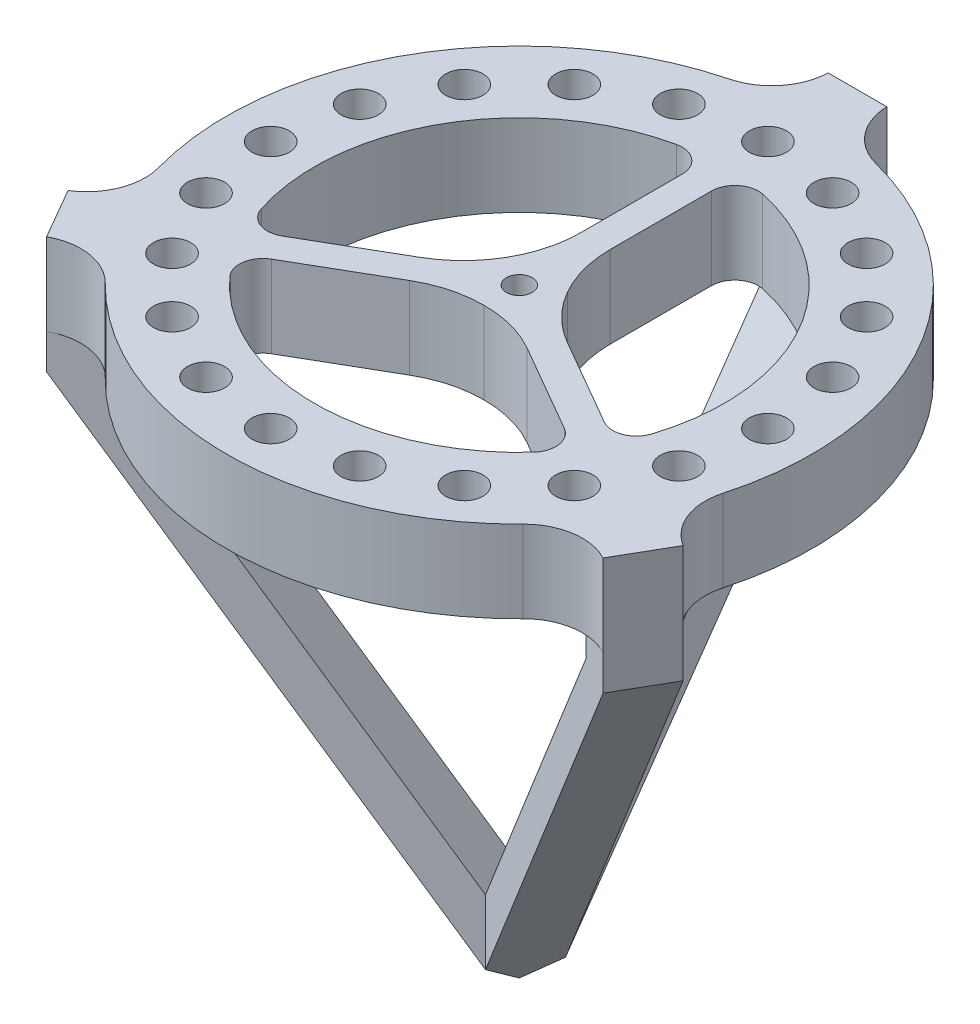
from build123d import *

# Parameters (mm, degrees)
SKETCH1_R           = 3
SKETCH1_R_2         = 1.1
BOSS_EXTRUDE1_DEPTH = 5
SKETCH4_R           = 25
SKETCH4_R_2         = 17.5
BOSS_EXTRUDE2_DEPTH = 5
SKETCH5_W           = 2.5
SKETCH5_H           = 14.772821971
BOSS_EXTRUDE3_DEPTH = 5
CIRPATTERN1_COUNT   = 3
SKETCH6_R           = 1.59
CUT_EXTRUDE1_DEPTH  = 5
FILLET1_R           = 10
FILLET2_R           = 2
CIRPATTERN2_COUNT   = 20
BOSS_EXTRUDE4_START = 2
SKETCH7_R           = 25
BOSS_EXTRUDE4_DEPTH = 2
CUT_EXTRUDE2_START  = -3
SKETCH8_R           = 1.1
CUT_EXTRUDE2_DEPTH  = 3
BOSS_EXTRUDE5_START = -10
BOSS_EXTRUDE5_DEPTH = 10
BOSS_EXTRUDE6_DEPTH = 2.5
CIRPATTERN3_COUNT   = 3
FILLET3_R           = 5
CUT_EXTRUDE6_DEPTH  = 10
CUT_EXTRUDE8_DEPTH  = 10
CUT_EXTRUDE9_DEPTH  = 10


with BuildPart() as part:
    # Sketch1 → Boss-Extrude1 (new body)
    with BuildSketch(Plane(origin=(0, 0, 0), x_dir=(1, 0, 0), z_dir=(0, 1, 0))):
        with Locations(Location((0, 0, 0), (0, 0, 270))):
            Circle(SKETCH1_R)
        with Locations(Location((0, 0, 0), (0, 0, 270))):
            Circle(SKETCH1_R_2, mode=Mode.SUBTRACT)
    extrude(amount=BOSS_EXTRUDE1_DEPTH)



with BuildPart() as body_2:
    # Sketch4 → Boss-Extrude2 (new body)
    with BuildSketch(Plane(origin=(0, 0, 0), x_dir=(1, 0, 0), z_dir=(0, 1, 0))):
        with Locations(Location((0, 0, 0), (0, 0, 270))):
            Circle(SKETCH4_R)
        with Locations(Location((0, 0, 0), (0, 0, 270))):
            Circle(SKETCH4_R_2, mode=Mode.SUBTRACT)
    extrude(amount=BOSS_EXTRUDE2_DEPTH)


with BuildPart() as part_1:
    add(part.part)

    add(body_2.part)  # Boss-Extrude3 merges body 2
    # Sketch5 → Boss-Extrude3 (add)
    with BuildSketch(Plane(origin=(0, 5, 0), x_dir=(1, 0, 0), z_dir=(0, 1, 0))):
        with Locations((0, 10.113589015)):
            Rectangle(SKETCH5_W, SKETCH5_H)
    boss_extrude3 = extrude(amount=-BOSS_EXTRUDE3_DEPTH)

    # CirPattern1: Boss-Extrude3 ×3 about axis
    cirpattern1_axis = Axis((0, 0, 0), (0, 1, 0))
    for i in range(1, CIRPATTERN1_COUNT):
        add(boss_extrude3.rotate(cirpattern1_axis, i * 360 / CIRPATTERN1_COUNT))

    # Sketch6 → Cut-Extrude1 (cut)
    with BuildSketch(Plane(origin=(0, 5, 0), x_dir=(1, 0, 0), z_dir=(0, 1, 0))):
        with Locations(Location((0, 21.227650027, 0), (0, 0, 270))):
            Circle(SKETCH6_R)
    cut_extrude1 = extrude(amount=-CUT_EXTRUDE1_DEPTH, mode=Mode.SUBTRACT)

    # Fillet1
    fillet1_edges = [part_1.edges().sort_by_distance(p)[0] for p in [
        (1.25, 2.5, -2.727178029),
        (-1.25, 2.5, -2.727178029),
        (1.736805453, 2.5, 2.446120769),
        (2.986805453, 2.5, 0.28105726),
        (-2.986805453, 2.5, 0.28105726),
        (-1.736805453, 2.5, 2.446120769),
    ]]
    fillet(fillet1_edges, radius=FILLET1_R)

    # Fillet2
    fillet2_edges = [part_1.edges().sort_by_distance(p)[0] for p in [
        (1.25, 2.5, -17.455300055),
        (-1.25, 2.5, -17.455300055),
        (15.741733278, 2.5, 7.645118273),
        (14.491733278, 2.5, 9.810181782),
        (-15.741733278, 2.5, 7.645118273),
        (-14.491733278, 2.5, 9.810181782),
    ]]
    fillet(fillet2_edges, radius=FILLET2_R)

    # CirPattern2: Cut-Extrude1 ×20 about axis
    cirpattern2_axis = Axis((0, 0, 0), (0, 1, 0))
    for i in range(1, CIRPATTERN2_COUNT):
        add(cut_extrude1.rotate(cirpattern2_axis, i * 360 / CIRPATTERN2_COUNT), mode=Mode.SUBTRACT)

    # Sketch7 → Boss-Extrude4 (add)
    with BuildSketch(Plane.XZ.offset(BOSS_EXTRUDE4_START)):
        with Locations(Location((0, 0, 0), (0, 0, 270))):
            Circle(SKETCH7_R)
        Polygon((7.540965356, 23.20870493), (4.434929563, 22.548496642), (3.453668816, 19.528486596), (5.578443862, 17.168684838), (8.684479655, 17.828893126), (9.665740402, 20.848903173), align=None, mode=Mode.SUBTRACT)
        Polygon((0, 24.403076508), (-2.75, 22.815363268), (-2.75, 19.639936787), (0, 18.052223547), (2.75, 19.639936787), (2.75, 22.815363268), align=None, mode=Mode.SUBTRACT)
        Polygon((14.343768482, 19.74250361), (11.18573732, 20.07442606), (9.319268465, 17.505452073), (10.610830772, 14.604555636), (13.768861934, 14.272633185), (15.635330789, 16.841607173), align=None, mode=Mode.SUBTRACT)
        Polygon((19.74250361, 14.343768482), (16.841607173, 15.635330789), (14.272633185, 13.768861934), (14.604555636, 10.610830772), (17.505452073, 9.319268465), (20.07442606, 11.18573732), align=None, mode=Mode.SUBTRACT)
        Polygon((23.20870493, 7.540965356), (20.848903173, 9.665740402), (17.828893126, 8.684479655), (17.168684838, 5.578443862), (19.528486596, 3.453668816), (22.548496642, 4.434929563), align=None, mode=Mode.SUBTRACT)
        Polygon((24.403076508, 0), (22.815363268, 2.75), (19.639936787, 2.75), (18.052223547, 0), (19.639936787, -2.75), (22.815363268, -2.75), align=None, mode=Mode.SUBTRACT)
        Polygon((23.20870493, -7.540965356), (22.548496642, -4.434929563), (19.528486596, -3.453668816), (17.168684838, -5.578443862), (17.828893126, -8.684479655), (20.848903173, -9.665740402), align=None, mode=Mode.SUBTRACT)
        Polygon((19.74250361, -14.343768482), (20.07442606, -11.18573732), (17.505452073, -9.319268465), (14.604555636, -10.610830772), (14.272633185, -13.768861934), (16.841607173, -15.635330789), align=None, mode=Mode.SUBTRACT)
        Polygon((14.343768482, -19.74250361), (15.635330789, -16.841607173), (13.768861934, -14.272633185), (10.610830772, -14.604555636), (9.319268465, -17.505452073), (11.18573732, -20.07442606), align=None, mode=Mode.SUBTRACT)
        Polygon((7.540965356, -23.20870493), (9.665740402, -20.848903173), (8.684479655, -17.828893126), (5.578443862, -17.168684838), (3.453668816, -19.528486596), (4.434929563, -22.548496642), align=None, mode=Mode.SUBTRACT)
        Polygon((0, -24.403076508), (2.75, -22.815363268), (2.75, -19.639936787), (0, -18.052223547), (-2.75, -19.639936787), (-2.75, -22.815363268), align=None, mode=Mode.SUBTRACT)
        Polygon((-7.540965356, -23.20870493), (-4.434929563, -22.548496642), (-3.453668816, -19.528486596), (-5.578443862, -17.168684838), (-8.684479655, -17.828893126), (-9.665740402, -20.848903173), align=None, mode=Mode.SUBTRACT)
        Polygon((-14.343768482, -19.74250361), (-11.18573732, -20.07442606), (-9.319268465, -17.505452073), (-10.610830772, -14.604555636), (-13.768861934, -14.272633185), (-15.635330789, -16.841607173), align=None, mode=Mode.SUBTRACT)
        Polygon((-19.74250361, -14.343768482), (-16.841607173, -15.635330789), (-14.272633185, -13.768861934), (-14.604555636, -10.610830772), (-17.505452073, -9.319268465), (-20.07442606, -11.18573732), align=None, mode=Mode.SUBTRACT)
        Polygon((-23.20870493, -7.540965356), (-20.848903173, -9.665740402), (-17.828893126, -8.684479655), (-17.168684838, -5.578443862), (-19.528486596, -3.453668816), (-22.548496642, -4.434929563), align=None, mode=Mode.SUBTRACT)
        Polygon((-24.403076508, 0), (-22.815363268, -2.75), (-19.639936787, -2.75), (-18.052223547, 0), (-19.639936787, 2.75), (-22.815363268, 2.75), align=None, mode=Mode.SUBTRACT)
        Polygon((-23.20870493, 7.540965356), (-22.548496642, 4.434929563), (-19.528486596, 3.453668816), (-17.168684838, 5.578443862), (-17.828893126, 8.684479655), (-20.848903173, 9.665740402), align=None, mode=Mode.SUBTRACT)
        Polygon((-19.74250361, 14.343768482), (-20.07442606, 11.18573732), (-17.505452073, 9.319268465), (-14.604555636, 10.610830772), (-14.272633185, 13.768861934), (-16.841607173, 15.635330789), align=None, mode=Mode.SUBTRACT)
        Polygon((-14.343768482, 19.74250361), (-15.635330789, 16.841607173), (-13.768861934, 14.272633185), (-10.610830772, 14.604555636), (-9.319268465, 17.505452073), (-11.18573732, 20.07442606), align=None, mode=Mode.SUBTRACT)
        Polygon((-7.540965356, 23.20870493), (-9.665740402, 20.848903173), (-8.684479655, 17.828893126), (-5.578443862, 17.168684838), (-3.453668816, 19.528486596), (-4.434929563, 22.548496642), align=None, mode=Mode.SUBTRACT)
    extrude(amount=-BOSS_EXTRUDE4_DEPTH)

    # Sketch8 → Cut-Extrude2 (cut)
    with BuildSketch(Plane(origin=(0, 0, 0), x_dir=(1, 0, 0), z_dir=(0, 1, 0)).offset(CUT_EXTRUDE2_START)):
        with Locations(Location((0, 0, 0), (0, 0, 90))):
            Circle(SKETCH8_R)
        with BuildLine():
            Line((1.25, 15.155444566), (1.25, 6.51440711))
            ThreePointArc((1.25, 6.51440711), (1.592400362, 3.920034502), (2.596153846, 1.503324718))
            Line((2.596153846, 1.503324718), (2.599994319, 1.496672824))
            ThreePointArc((2.599994319, 1.496672824), (4.191049643, -0.580958085), (6.266642048, -2.1746718))
            Line((6.266642048, -2.1746718), (13.75, -6.495190528))
            ThreePointArc((13.75, -6.495190528), (15.468421208, -6.629652771), (16.653225806, -5.377738394))
            ThreePointArc((16.653225806, -5.377738394), (15.155444566, 8.75), (3.669354839, 17.110985801))
            ThreePointArc((3.669354839, 17.110985801), (1.992762886, 16.710872108), (1.25, 15.155444566))
        make_face()
        with BuildLine():
            Line((-2.599994319, 1.496672824), (-2.596153846, 1.503324718))
            ThreePointArc((-2.596153846, 1.503324718), (-1.592400362, 3.920034502), (-1.25, 6.51440711))
            Line((-1.25, 6.51440711), (-1.25, 15.155444566))
            ThreePointArc((-1.25, 15.155444566), (-1.992762886, 16.710872108), (-3.669354839, 17.110985801))
            ThreePointArc((-3.669354839, 17.110985801), (-15.155444566, 8.75), (-16.653225806, -5.377738394))
            ThreePointArc((-16.653225806, -5.377738394), (-15.468421208, -6.629652771), (-13.75, -6.495190528))
            Line((-13.75, -6.495190528), (-6.266642048, -2.1746718))
            ThreePointArc((-6.266642048, -2.1746718), (-4.191049643, -0.580958085), (-2.599994319, 1.496672824))
        make_face()
        with BuildLine():
            Line((0.003840473, -2.999997542), (-0.003840473, -2.999997542))
            ThreePointArc((-0.003840473, -2.999997542), (-2.598649282, -3.339076417), (-5.016642048, -4.33973531))
            Line((-5.016642048, -4.33973531), (-12.5, -8.660254038))
            ThreePointArc((-12.5, -8.660254038), (-13.475658322, -10.081219337), (-12.983870968, -11.733247406))
            ThreePointArc((-12.983870968, -11.733247406), (0, -17.5), (12.983870968, -11.733247406))
            ThreePointArc((12.983870968, -11.733247406), (13.475658322, -10.081219337), (12.5, -8.660254038))
            Line((12.5, -8.660254038), (5.016642048, -4.33973531))
            ThreePointArc((5.016642048, -4.33973531), (2.598649282, -3.339076417), (0.003840473, -2.999997542))
        make_face()
    extrude(amount=CUT_EXTRUDE2_DEPTH, mode=Mode.SUBTRACT)

    # Sketch9 → Boss-Extrude5 (add)
    with BuildSketch(Plane(origin=(0, 5, 0), x_dir=(1, 0, 0), z_dir=(0, 1, 0)).offset(BOSS_EXTRUDE5_START)):
        with BuildLine():
            Line((-2.5, 24.874685928), (-2.5, 28.874685928))
            Line((-2.5, 28.874685928), (2.5, 28.874685928))
            Line((2.5, 28.874685928), (2.5, 24.874685928))
            ThreePointArc((2.5, 24.874685928), (0, 25), (-2.5, 24.874685928))
        make_face()
    boss_extrude5 = extrude(amount=BOSS_EXTRUDE5_DEPTH)

    # Sketch10 → Boss-Extrude6 (add, symmetric)
    with BuildSketch(Plane(origin=(0, 0, 0), x_dir=(0, 0, -1), z_dir=(1, 0, 0))):
        Polygon((28.874685928, -5), (0, -46.237325153), (0, -40.703700169), (25, -5), align=None)
    boss_extrude6 = extrude(amount=BOSS_EXTRUDE6_DEPTH, both=True)

    # CirPattern3: Boss-Extrude5, Boss-Extrude6 ×3 about axis
    cirpattern3_axis = Axis((0, 0, 0), (0, 1, 0))
    add([boss_extrude5.rotate(cirpattern3_axis, i * 360 / CIRPATTERN3_COUNT) for i in range(1, CIRPATTERN3_COUNT)])
    add([boss_extrude6.rotate(cirpattern3_axis, i * 360 / CIRPATTERN3_COUNT) for i in range(1, CIRPATTERN3_COUNT)])

    # Fillet3
    # the kernel refuses this fillet: 5 mm, written as the material it adds along each edge
    with BuildSketch(Plane(origin=(-22.792109925, -2, 10.272279454), x_dir=(-0.3402913748716829, 0, -0.940320041362482), z_dir=(0, 1, 0)), Plane(origin=(20.292109925, -2, 14.602406473), x_dir=(-0.6441953560717024, 0, 0.7648609960088516), z_dir=(0, 1, 0)), Plane(origin=(-2.5, 5, -24.874685928), x_dir=(-0.9844867309433856, -6.44891940416167e-14, 0.1754590453536262), z_dir=(0, -1, 0)), Plane(origin=(2.5, -2, -24.874685928), x_dir=(0.9844867309433848, -4.8982501004772966e-15, 0.17545904535363072), z_dir=(0, 1, 0))) as fillet3_piece_1:
        with BuildLine():
            CenterArc((4.187198002, 4.985489169), FILLET3_R, 192.093547668, 73.540249999)
            Line((-0.701836181, 3.937946924), (0, 0))
            ThreePointArc((0, 0), (1.903271819, 0.072554154), (3.806543638, 0))
        make_face()
    extrude(amount=7)
    with BuildSketch(Plane(origin=(-20.292109925, -2, 14.602406473), x_dir=(0.6441953560717029, 0, 0.7648609960088512), z_dir=(0, 1, 0)), Plane(origin=(22.792109925, -2, 10.272279454), x_dir=(0.340291374871684, 0, -0.9403200413624816), z_dir=(0, 1, 0))) as fillet3_piece_2:
        with BuildLine():
            CenterArc((4.187198002, -4.985489169), FILLET3_R, 94.366202332, 73.540249999)
            Line((-0.701836181, -3.937946924), (0, 0))
            ThreePointArc((0, 0), (1.903271819, -0.072554154), (3.806543638, 0))
        make_face()
    extrude(amount=7)

    # Sketch15 → Cut-Extrude6 (cut)
    with BuildSketch(Plane(origin=(0, -15.211614289, -21.724436626), x_dir=(-1, 0, 0), z_dir=(0, -0.573576436351044, -0.8191520442889934))):
        Polygon((-2.5, -37.875399421), (-2.5, -35.35895073), (-1.25, -34.100726384), (1.25, -34.100726384), (2.5, -35.35895073), (2.5, -37.875399421), align=None)
    extrude(amount=CUT_EXTRUDE6_DEPTH, mode=Mode.SUBTRACT)

    # Sketch16 → Cut-Extrude8 (cut)
    with BuildSketch(Plane(origin=(18.813914001, -15.211614289, 10.862218313), x_dir=(0.3184955948481879, -0.25751325010183657, -0.912275990084299), z_dir=(0.7094064799162216, -0.5735764363510442, 0.4095760221445002))):
        Polygon((11.906723876, -35.955191668), (9.533468926, -36.741105748), (8.742383942, -34.352236022), (9.533468926, -32.764844119), (11.906723876, -31.978930039), (13.488893843, -32.780407862), (13.598510447, -34.383363508), align=None)
    extrude(amount=CUT_EXTRUDE8_DEPTH, mode=Mode.SUBTRACT)

    # Sketch17 → Cut-Extrude9 (cut)
    with BuildSketch(Plane(origin=(-18.813914001, -15.211614289, 10.862218313), x_dir=(0.3184955948481813, 0.25751325010182907, 0.9122759900843034), z_dir=(-0.7094064799162275, -0.5735764363510439, 0.4095760221444903))):
        Polygon((-13.488893843, -32.780407862), (-11.906723876, -31.978930039), (-9.533468926, -32.764844119), (-8.742383942, -34.352236022), (-8.16185588, -35.5171242), (-11.862743169, -37.361480565), (-13.757958277, -33.55854007), align=None)
    extrude(amount=CUT_EXTRUDE9_DEPTH, mode=Mode.SUBTRACT)


solid = part_1.part
